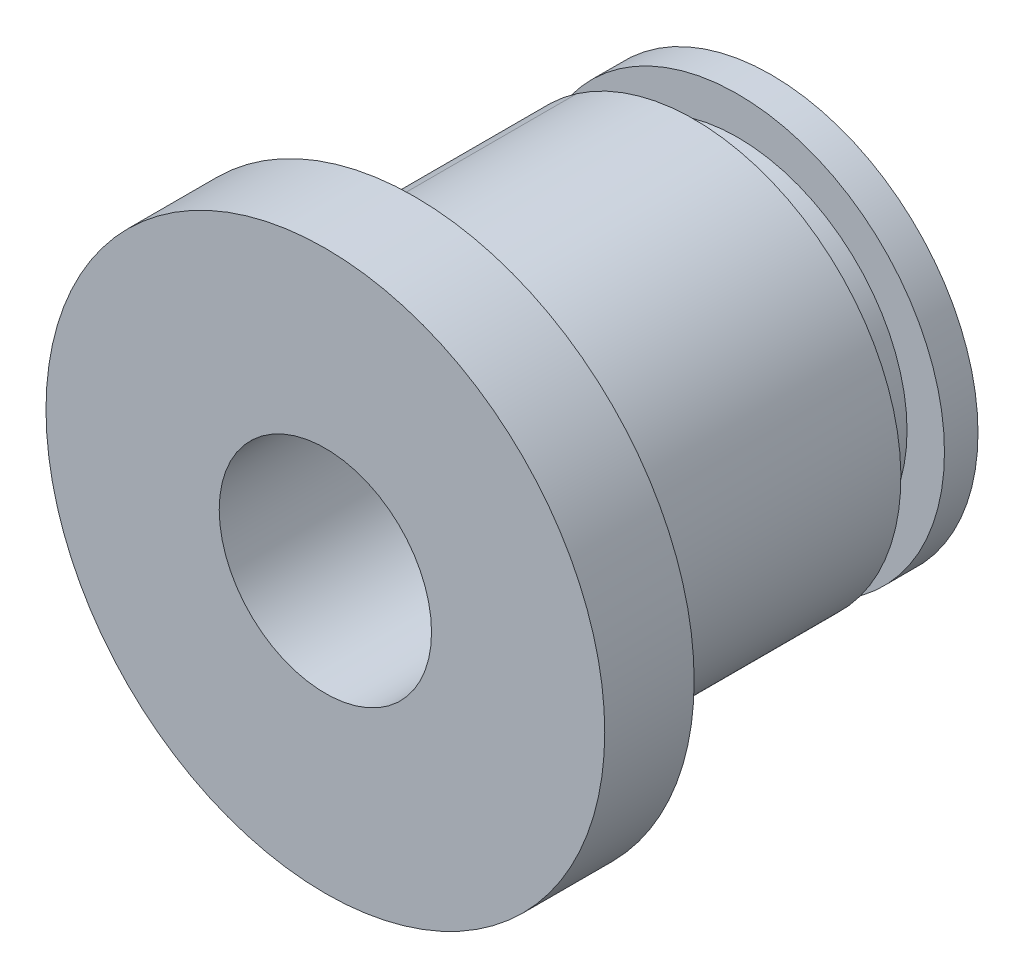
from build123d import *

# Parameters (mm, degrees)
SKETCH1_R           = 6.35
BOSS_EXTRUDE1_DEPTH = 2.032
SKETCH2_R           = 4.699
BOSS_EXTRUDE2_DEPTH = 8.1026
SKETCH4_W           = 0.9906
SKETCH4_H           = 0.8509
SKETCH8_R           = 2.413
CUT_EXTRUDE2_DEPTH  = 15.24


with BuildPart() as part:
    # Sketch1 → Boss-Extrude1 (new body)
    with BuildSketch(Plane.XY):
        Circle(SKETCH1_R)
    extrude(amount=BOSS_EXTRUDE1_DEPTH)

    # Sketch2 → Boss-Extrude2 (add)
    with BuildSketch(Plane(origin=(0, 0, 0), x_dir=(-1, 0, 0), z_dir=(0, 0, -1))):
        Circle(SKETCH2_R)
    extrude(amount=BOSS_EXTRUDE2_DEPTH)

    # Sketch4 → Cut-Revolve1 (revolve, cut)
    with BuildSketch(Plane(origin=(0, 0, 0), x_dir=(0, 0, -1), z_dir=(1, 0, 0))):
        with Locations((6.8453, 4.27355)):
            Rectangle(SKETCH4_W, SKETCH4_H)
    revolve(axis=Axis((0, 0, 6.549062663), (0, 0, -1)), mode=Mode.SUBTRACT)

    # Sketch8 → Cut-Extrude2 (cut)
    with BuildSketch(Plane.XY.offset(2.032)):
        Circle(SKETCH8_R)
    extrude(amount=-CUT_EXTRUDE2_DEPTH, mode=Mode.SUBTRACT)


solid = part.part
